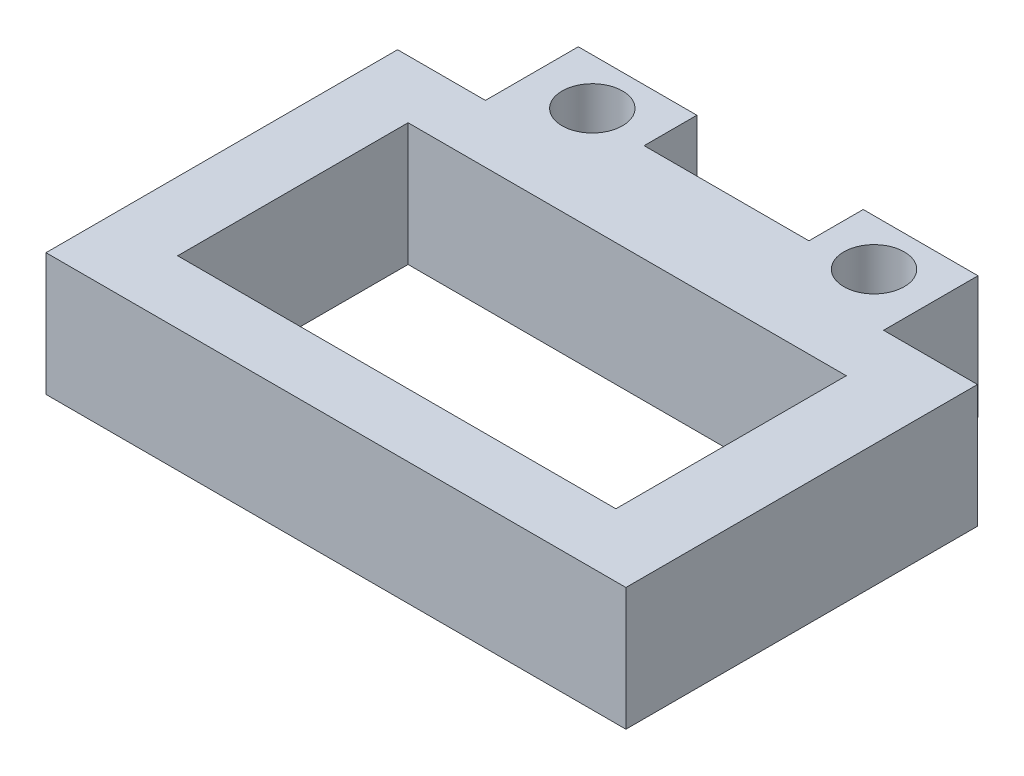
from build123d import *

# Parameters (mm, degrees)
SKETCH1_R           = 1.6
SKETCH1_W           = 23.2
SKETCH1_H           = 12.2
BOSS_EXTRUDE5_DEPTH = 6.5


with BuildPart() as part:
    # Sketch1 → Boss-Extrude5 (new body)
    with BuildSketch(Plane(origin=(0, 0, 0), x_dir=(1, 0, 0), z_dir=(0, 1, 0))):
        Polygon((23.208363186, 32.900104101), (23.208363186, 35.692923472), (16.930444564, 35.692923472), (16.930444564, 30.773845417), (12.281037655, 30.773845417), (12.281037655, 12.159890469), (42.983706025, 12.159890469), (42.983706025, 30.773845417), (38.010611335, 30.773845417), (38.010611335, 35.773845417), (31.932950893, 35.773845417), (31.932950893, 32.900104101), align=None)
        with Locations((20.126218407, 33.238361828)):
            Circle(SKETCH1_R, mode=Mode.SUBTRACT)
        with Locations((34.961491223, 33.319283774)):
            Circle(SKETCH1_R, mode=Mode.SUBTRACT)
        with Locations((27.508406256, 21.602944359)):
            Rectangle(SKETCH1_W, SKETCH1_H, mode=Mode.SUBTRACT)
    extrude(amount=BOSS_EXTRUDE5_DEPTH)


solid = part.part
